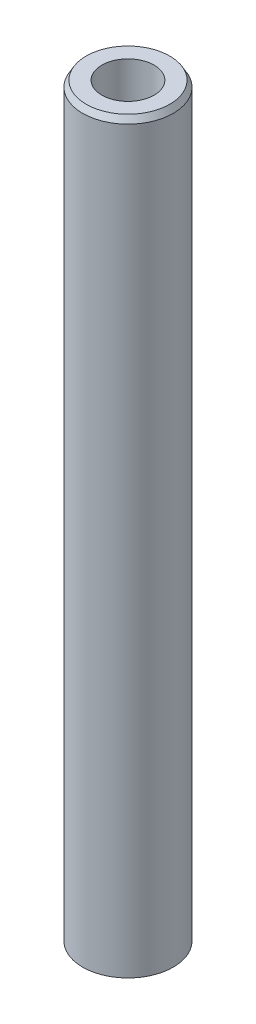
from build123d import *
from OCP.BRepFilletAPI import BRepFilletAPI_MakeChamfer

# Parameters (mm, degrees)
SKETCH1_R           = 32.5
BOSS_EXTRUDE1_DEPTH = 537.153292803
SKETCH2_R           = 18.720998138
CUT_EXTRUDE1_DEPTH  = 540.116091365
CHAMFER1_SIZE       = 4.380440005
CHAMFER1_SIZE2      = 2.529048216


with BuildPart() as part:
    # Sketch1 → Boss-Extrude1 (new body)
    with BuildSketch(Plane(origin=(0, 0, 0), x_dir=(1, 0, 0), z_dir=(0, 1, 0))):
        Circle(SKETCH1_R)
    extrude(amount=BOSS_EXTRUDE1_DEPTH)

    # Sketch2 → Cut-Extrude1 (cut, through all)
    with BuildSketch(Plane(origin=(0, 0, 0), x_dir=(1, 0, 0), z_dir=(0, 1, 0))):
        Circle(SKETCH2_R)
    extrude(amount=CUT_EXTRUDE1_DEPTH, mode=Mode.SUBTRACT)

    # Chamfer1: one chamfer whose edges measure the first distance from different faces: ONE call of the kernel's chamfer builder (chamfer() names one face for all edges)
    chamfer1_edges_1 = [part.edges().sort_by_distance(p)[0] for p in [
        (-32.5, 537.153292803, 0),
    ]]
    chamfer1_side_1 = [part.faces().sort_by_distance(p)[0] for p in [
        (-32.5, 268.576646401, 0),
    ]]
    chamfer1_edges_2 = [part.edges().sort_by_distance(p)[0] for p in [
        (-32.5, 0, 0),
    ]]
    chamfer1_side_2 = [part.faces().sort_by_distance(p)[0] for p in [
        (-31.580761184, 0, 0),
    ]]
    chamfer1 = BRepFilletAPI_MakeChamfer(part.part.solid().wrapped)
    for e in chamfer1_edges_1:
        chamfer1.Add(CHAMFER1_SIZE, CHAMFER1_SIZE2, e.wrapped, chamfer1_side_1[0].wrapped)  # the first distance lies on this face
    for e in chamfer1_edges_2:
        chamfer1.Add(CHAMFER1_SIZE, CHAMFER1_SIZE2, e.wrapped, chamfer1_side_2[0].wrapped)  # the first distance lies on this face
    add(Compound.cast(chamfer1.Shape()), mode=Mode.REPLACE)


solid = part.part
